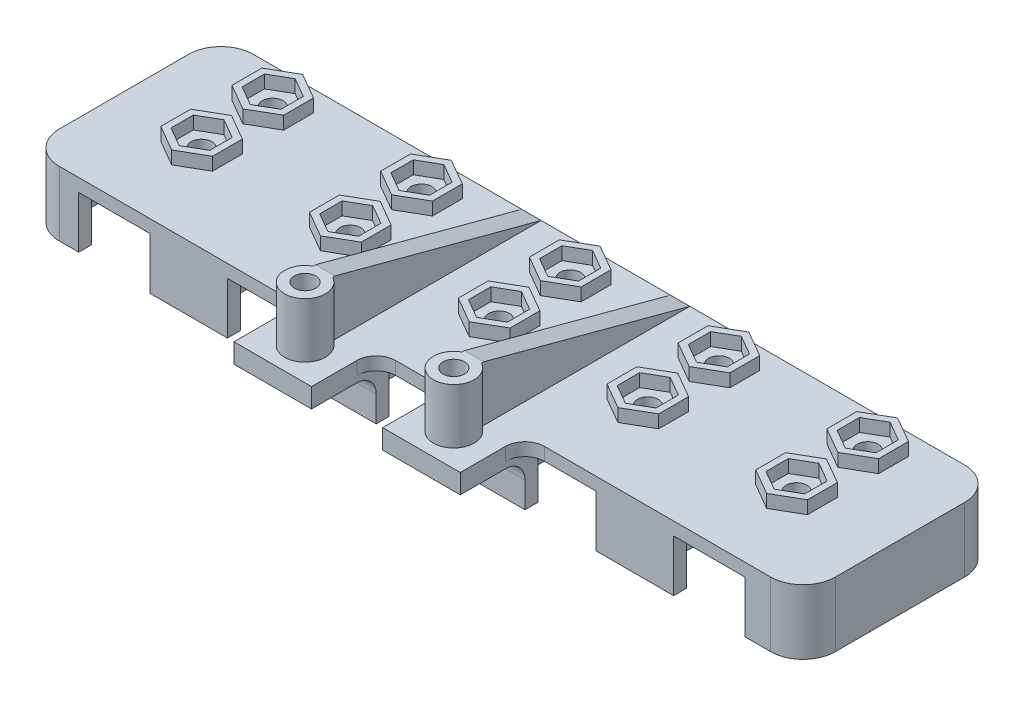
from build123d import *

# Parameters (mm, degrees)
BOSS_EXTRUDE1_DEPTH     = 10
SKETCH1_5_W             = 5
SKETCH1_5_H             = 26
CUT_EXTRUDE3_DEPTH      = 6
BOSS_EXTRUDE2_START     = 10
BOSS_EXTRUDE2_DEPTH     = 2
SKETCH1_9_W             = 11
SKETCH1_9_H             = 28
CUT_EXTRUDE4_DEPTH      = 8
CUT_EXTRUDE5_REACH      = 65
SKETCH1_10_R            = 1.6
LPATTERN4_COUNT         = 5
LPATTERN4_PITCH         = 23
SKETCH4_W               = 12
SKETCH4_H               = 10
BOSS_EXTRUDE3_DEPTH     = 3
FILLET2_R               = 3
SKETCH5_R               = 3.15
BOSS_EXTRUDE5_DEPTH     = 8.5
CUT_EXTRUDE6_DEPTH      = 66.76473219
CUT_EXTRUDE6_DEPTH_BACK = 66.76473219
SKETCH5_3_R             = 1.65
SKETCH6_W               = 1
SKETCH6_H               = 8.5
SKETCH6_W_2             = 31.85
SKETCH6_H_2             = 1
BOSS_EXTRUDE6_DEPTH     = 1.5
SKETCH7_W               = 1
SKETCH7_H               = 8.5
SKETCH7_W_2             = 31.85
SKETCH7_H_2             = 1
BOSS_EXTRUDE7_DEPTH     = 1.5


with BuildPart() as part:
    # Sketch1 → Boss-Extrude1 (new body)
    with BuildSketch(Plane(origin=(0, 0, 0), x_dir=(1, 0, 0), z_dir=(0, 1, 0))):
        with BuildLine():
            Line((-55, -15), (55, -15))
            ThreePointArc((55, -15), (58.535533906, -13.535533906), (60, -10))
            Line((60, -10), (60, 10))
            ThreePointArc((60, 10), (58.535533906, 13.535533906), (55, 15))
            Line((55, 15), (-55, 15))
            ThreePointArc((-55, 15), (-58.535533906, 13.535533906), (-60, 10))
            Line((-60, 10), (-60, -10))
            ThreePointArc((-60, -10), (-58.535533906, -13.535533906), (-55, -15))
        make_face()
    extrude(amount=BOSS_EXTRUDE1_DEPTH)

    # Sketch1<5> → Cut-Extrude3 (cut)
    with BuildSketch(Plane(origin=(0, 0, 0), x_dir=(1, 0, 0), z_dir=(0, 1, 0))):
        with Locations((-38.5, 0)):
            Rectangle(SKETCH1_5_W, SKETCH1_5_H)
        with Locations((-54.5, 0)):
            Rectangle(SKETCH1_5_W, SKETCH1_5_H)
    cut_extrude3 = extrude(amount=CUT_EXTRUDE3_DEPTH, mode=Mode.SUBTRACT)

    # Sketch1<8> → Boss-Extrude2 (add)
    # profile 1 of 2: a face of its own
    with BuildSketch(Plane(origin=(0, 0, 0), x_dir=(1, 0, 0), z_dir=(0, 1, 0)).offset(BOSS_EXTRUDE2_START)):
        Polygon((-46.5, 3.118802154), (-50.5, 0.809401077), (-50.5, -3.809401077), (-46.5, -6.118802154), (-42.5, -3.809401077), (-42.5, 0.809401077), align=None)
        Polygon((-46.5, 1.964101615), (-49.5, 0.232050808), (-49.5, -3.232050808), (-46.5, -4.964101615), (-43.5, -3.232050808), (-43.5, 0.232050808), align=None, mode=Mode.SUBTRACT)
    # profile 2 of 2: a face of its own
    with BuildSketch(Plane(origin=(0, 0, 0), x_dir=(1, 0, 0), z_dir=(0, 1, 0)).offset(BOSS_EXTRUDE2_START)):
        Polygon((-46.5, 4.881197846), (-42.5, 7.190598923), (-42.5, 11.809401077), (-46.5, 14.118802154), (-50.5, 11.809401077), (-50.5, 7.190598923), align=None)
        Polygon((-46.5, 6.035898385), (-43.5, 7.767949192), (-43.5, 11.232050808), (-46.5, 12.964101615), (-49.5, 11.232050808), (-49.5, 7.767949192), align=None, mode=Mode.SUBTRACT)
    boss_extrude2 = extrude(amount=BOSS_EXTRUDE2_DEPTH)

    # Sketch1<9> → Cut-Extrude4 (cut)
    with BuildSketch(Plane(origin=(0, 0, 0), x_dir=(1, 0, 0), z_dir=(0, 1, 0))):
        with Locations((-46.5, -1)):
            Rectangle(SKETCH1_9_W, SKETCH1_9_H)
    cut_extrude4 = extrude(amount=CUT_EXTRUDE4_DEPTH, mode=Mode.SUBTRACT)

    # Sketch1<10> → Cut-Extrude5 (cut, up to next)
    with BuildSketch(Plane(origin=(0, 0, 0), x_dir=(1, 0, 0), z_dir=(0, 1, 0)), mode=Mode.PRIVATE) as cut_extrude5_sk1:
        with Locations(Location((-46.5, 9.5, 0), (0, 0, 90))):
            Circle(SKETCH1_10_R)
    cut_extrude5_tool1 = extrude(cut_extrude5_sk1.sketch, amount=CUT_EXTRUDE5_REACH, mode=Mode.PRIVATE) & part.part
    # Sketch1<10> → Cut-Extrude5 (cut, up to next)
    with BuildSketch(Plane(origin=(0, 0, 0), x_dir=(1, 0, 0), z_dir=(0, 1, 0)), mode=Mode.PRIVATE) as cut_extrude5_sk2:
        with Locations(Location((-46.5, -1.5, 0), (0, 0, 90))):
            Circle(SKETCH1_10_R)
    cut_extrude5_tool2 = extrude(cut_extrude5_sk2.sketch, amount=CUT_EXTRUDE5_REACH, mode=Mode.PRIVATE) & part.part
    cut_extrude5_1 = cut_extrude5_tool1.solids().sort_by_distance((-46.5, 0, -9.5))[0]
    add(cut_extrude5_1, mode=Mode.SUBTRACT)
    cut_extrude5_2 = cut_extrude5_tool2.solids().sort_by_distance((-46.5, 0, 1.5))[0]
    add(cut_extrude5_2, mode=Mode.SUBTRACT)
    cut_extrude5 = cut_extrude5_1 + cut_extrude5_2  # Cut-Extrude5 as one shape, for the pattern or mirror that repeats it

    # LPattern4: Cut-Extrude3, Boss-Extrude2, Cut-Extrude4, Cut-Extrude5 ×5
    with Locations(*[(i * LPATTERN4_PITCH, 0, 0) for i in range(1, LPATTERN4_COUNT)]):
        add(cut_extrude3, mode=Mode.SUBTRACT)
        add(boss_extrude2)
        add(cut_extrude4, mode=Mode.SUBTRACT)
        add(cut_extrude5, mode=Mode.SUBTRACT)

    # Sketch4 → Boss-Extrude3 (add)
    with BuildSketch(Plane(origin=(0, 10, 0), x_dir=(1, 0, 0), z_dir=(0, 1, 0))):
        with Locations((11, -20)):
            Rectangle(SKETCH4_W, SKETCH4_H)
        with Locations((-12, -20)):
            Rectangle(SKETCH4_W, SKETCH4_H)
    extrude(amount=-BOSS_EXTRUDE3_DEPTH)

    # Fillet2
    # the kernel refuses this fillet: 3 mm, written as the material it adds along each edge
    with BuildSketch(Plane(origin=(17, 10, 15), x_dir=(0, 0, 1), z_dir=(0, -1, 0)), Plane(origin=(-18, 10, 15), x_dir=(-1, 0, 0), z_dir=(0, -1, 0)), Plane(origin=(-6, 10, 15), x_dir=(0, 0, 1), z_dir=(0, -1, 0))) as fillet2_piece_1:
        with BuildLine():
            CenterArc((FILLET2_R, -FILLET2_R), FILLET2_R, 90, 90)
            Line((0, -FILLET2_R), (0, 0))
            Line((0, 0), (FILLET2_R, 0))
        make_face()
    extrude(amount=2)
    with BuildSketch(Plane(origin=(5, 10, 15), x_dir=(0, 0, 1), z_dir=(0, -1, 0))) as fillet2_piece_2:
        with BuildLine():
            CenterArc((FILLET2_R, FILLET2_R), FILLET2_R, 180, 90)
            Line((0, FILLET2_R), (0, 0))
            Line((0, 0), (FILLET2_R, 0))
        make_face()
    extrude(amount=2)
    with BuildSketch(Plane(origin=(17, 7, 15), x_dir=(0, -1, 0), z_dir=(-1, 0, 0)), Plane(origin=(-6, 7, 15), x_dir=(0, -1, 0), z_dir=(-1, 0, 0))) as fillet2_piece_3:
        with BuildLine():
            CenterArc((FILLET2_R, FILLET2_R), FILLET2_R, 180, 90)
            Line((0, FILLET2_R), (0, 0))
            Line((0, 0), (FILLET2_R, 0))
        make_face()
    extrude(amount=12)

    # Sketch5 → Boss-Extrude5 (add)
    with BuildSketch(Plane(origin=(0, 10, 0), x_dir=(1, 0, 0), z_dir=(0, 1, 0))):
        with Locations(Location((-12, -20, 0), (0, 0, 90))):
            Circle(SKETCH5_R)
        with Locations(Location((11, -20, 0), (0, 0, 90))):
            Circle(SKETCH5_R)
    extrude(amount=BOSS_EXTRUDE5_DEPTH)

    # Sketch5<3> → Cut-Extrude6 (cut, two sides: drawn at the far end of the back side and taken through both)
    with BuildSketch(Plane(origin=(0, 10, 0), x_dir=(1, 0, 0), z_dir=(0, 1, 0)).offset(-CUT_EXTRUDE6_DEPTH_BACK)):
        with Locations(Location((-12, -20, 0), (0, 0, 90))):
            Circle(SKETCH5_3_R)
        with Locations(Location((11, -20, 0), (0, 0, 90))):
            Circle(SKETCH5_3_R)
    extrude(amount=CUT_EXTRUDE6_DEPTH + CUT_EXTRUDE6_DEPTH_BACK, mode=Mode.SUBTRACT)

    # Sketch6 → Boss-Extrude6 (add, symmetric)
    with BuildSketch(Plane(origin=(11, 0, 0), x_dir=(0, 0, -1), z_dir=(1, 0, 0))):
        Polygon((-16.85, 10), (15, 10), (-16.85, 18.5), align=None)
        with Locations((-17.35, 14.25)):
            Rectangle(SKETCH6_W, SKETCH6_H)
        with Locations((-0.925, 9.5)):
            Rectangle(SKETCH6_W_2, SKETCH6_H_2)
        with Locations((-17.35, 9.5)):
            Rectangle(SKETCH6_W, SKETCH6_H_2)
    extrude(amount=BOSS_EXTRUDE6_DEPTH, both=True)

    # Sketch7 → Boss-Extrude7 (add, symmetric)
    with BuildSketch(Plane(origin=(-12, 0, 0), x_dir=(0, 0, -1), z_dir=(1, 0, 0))):
        Polygon((-16.85, 10), (15, 10), (-16.85, 18.5), align=None)
        with Locations((-17.35, 14.25)):
            Rectangle(SKETCH7_W, SKETCH7_H)
        with Locations((-0.925, 9.5)):
            Rectangle(SKETCH7_W_2, SKETCH7_H_2)
        with Locations((-17.35, 9.5)):
            Rectangle(SKETCH7_W, SKETCH7_H_2)
    extrude(amount=BOSS_EXTRUDE7_DEPTH, both=True)


solid = part.part
